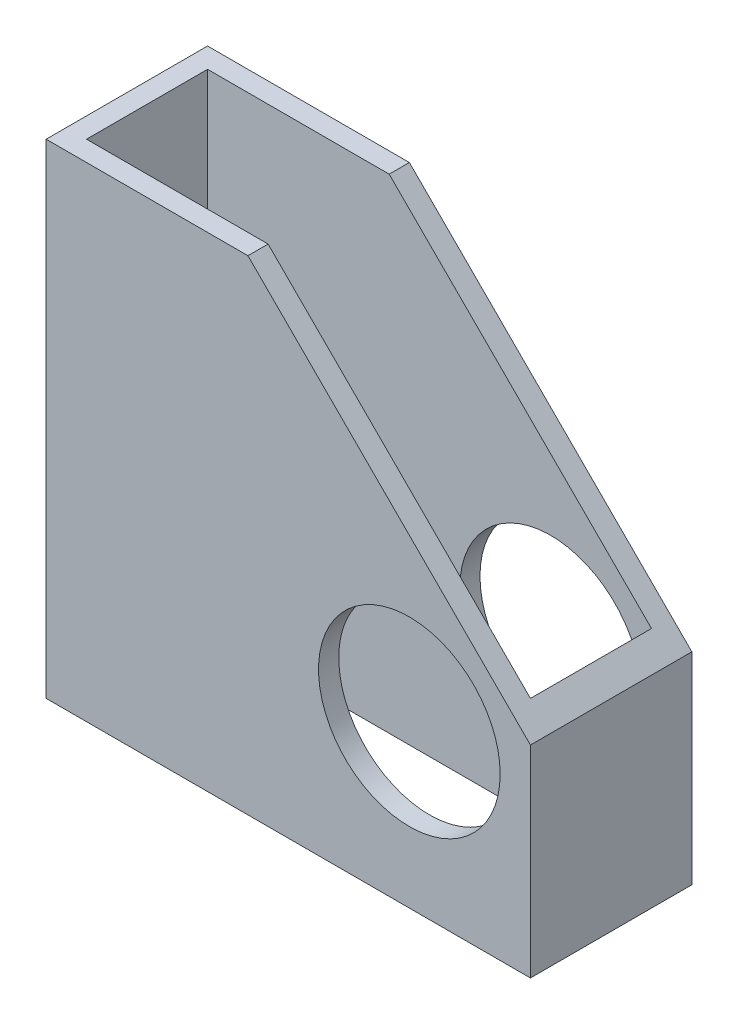
from build123d import *

# Parameters (mm, degrees)
SKETCH1_W                       = 76.2
SKETCH1_H                       = 76.2
SKETCH1_R                       = 14.2875
BOSS_EXTRUDE1_DEPTH             = 12.7
F_1_4_0_25_DIAMETER_HOLE1_D     = 6.35
F_1_4_0_25_DIAMETER_HOLE1_DEPTH = 5.08
F_1_4_0_25_DIAMETER_HOLE1_TIP   = 1.907732465
CHAMFER1_SIZE                   = 44.45
SKETCH7_W                       = 69.85
SKETCH7_H                       = 19.05
CUT_EXTRUDE1_DEPTH              = 87.135590786


with BuildPart() as part:
    # Sketch1 → Boss-Extrude1 (new, symmetric)
    with BuildSketch(Plane.XY):
        Rectangle(SKETCH1_W, SKETCH1_H)
        with Locations((19.05, -12.7)):
            Circle(SKETCH1_R, mode=Mode.SUBTRACT)
    extrude(amount=BOSS_EXTRUDE1_DEPTH, both=True)

    # 1/4 (0.25) Diameter Hole1
    with Locations(Plane.ZY.offset(38.1)):
        with Locations((0, -9.525), (0, -28.575)):
            Hole(F_1_4_0_25_DIAMETER_HOLE1_D / 2, depth=F_1_4_0_25_DIAMETER_HOLE1_DEPTH)
            with Locations((0, 0, -(F_1_4_0_25_DIAMETER_HOLE1_DEPTH + F_1_4_0_25_DIAMETER_HOLE1_TIP / 2))):  # 118° drill point
                Cone(0, F_1_4_0_25_DIAMETER_HOLE1_D / 2, F_1_4_0_25_DIAMETER_HOLE1_TIP, mode=Mode.SUBTRACT)

    # Chamfer1
    chamfer1_edges = [part.edges().sort_by_distance(p)[0] for p in [
        (38.1, 38.1, 0),
    ]]
    chamfer(chamfer1_edges, length=CHAMFER1_SIZE)

    # Sketch7 → Cut-Extrude1 (cut, through all)
    with BuildSketch(Plane.XZ.offset(38.1)):
        Rectangle(SKETCH7_W, SKETCH7_H)
    extrude(amount=-CUT_EXTRUDE1_DEPTH, mode=Mode.SUBTRACT)


solid = part.part
